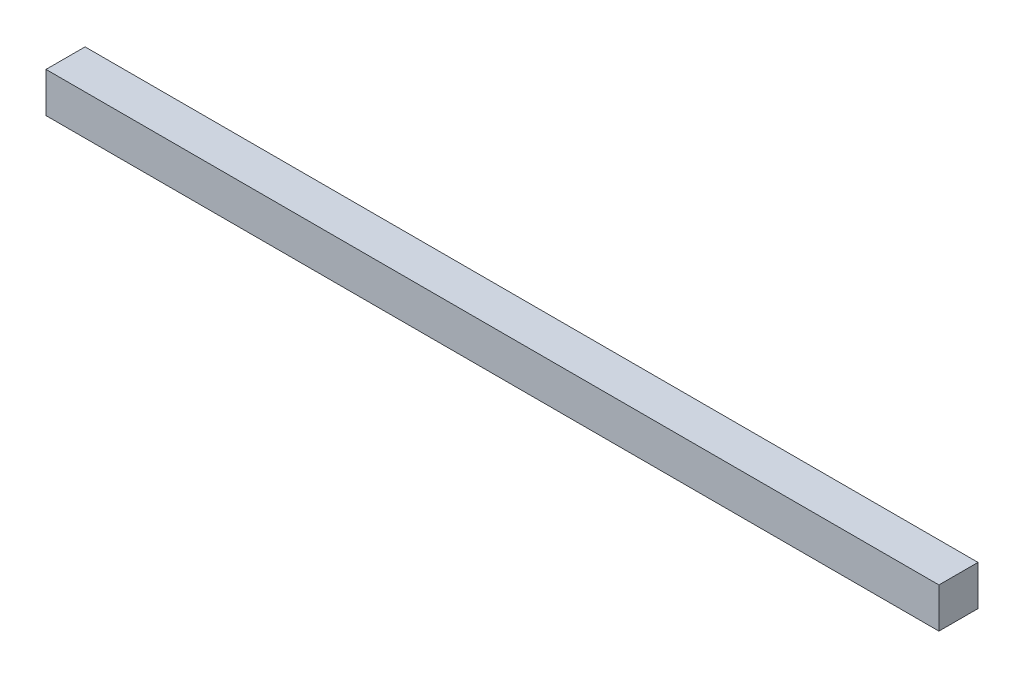
from build123d import *

# Parameters (mm, degrees)
SKETCH_1379_W      = 137.175
SKETCH_1379_H      = 6.15
EXTRUDE_1387_DEPTH = 6


with BuildPart() as part:
    # Sketch 1379 → Extrude 1387 (new body)
    with BuildSketch(Plane.XY):
        with Locations((68.4875, 0)):
            Rectangle(SKETCH_1379_W, SKETCH_1379_H)
    extrude(amount=EXTRUDE_1387_DEPTH)


solid = part.part
